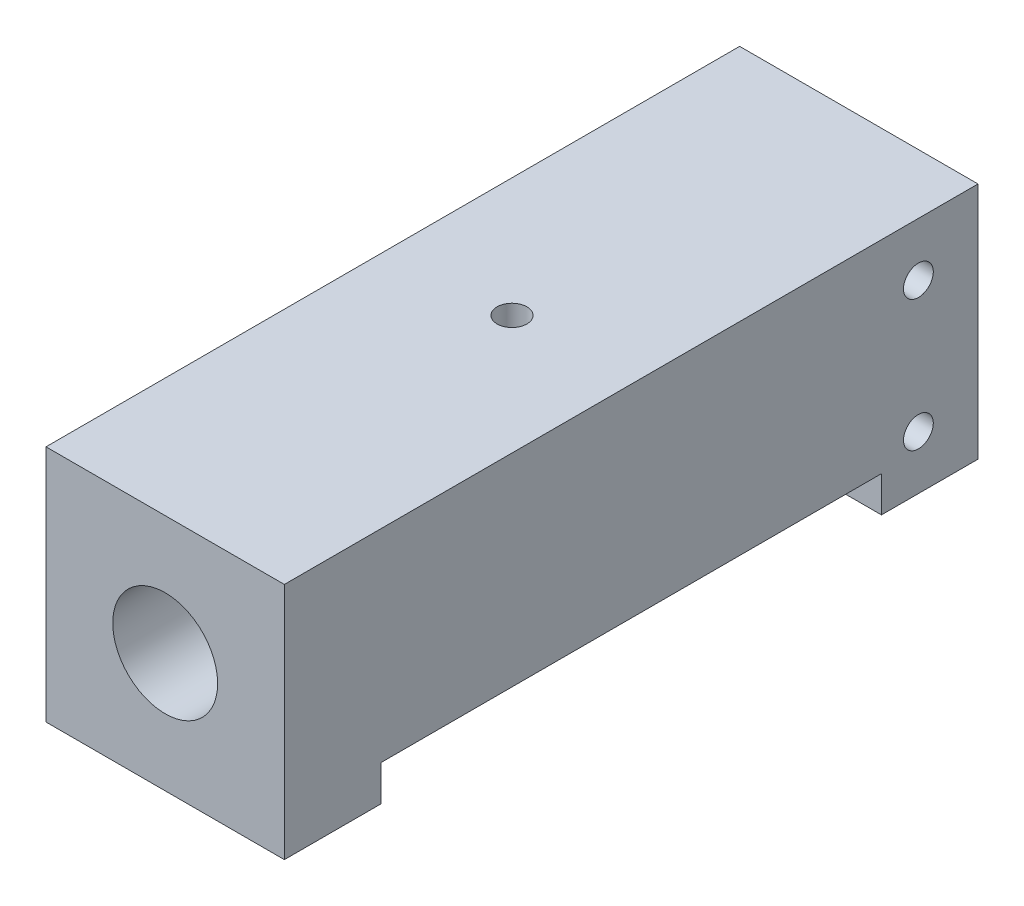
from build123d import *

# Parameters (mm, degrees)
SCHIZZO1_W                   = 20
SCHIZZO1_H                   = 20
ESTRUSIONE_ESTRUSIONE1_DEPTH = 58.2
SCHIZZO2_R                   = 2.05
TAGLIO_ESTRUSIONE1_DEPTH     = 60.893572276
FORO_FILETTATO_G1_8_1_D      = 8.8
FORO_FILETTATO_G1_8_1_DEPTH  = 10
FORO_FILETTATO_G1_8_1_TIP    = 2.643786724
M3_TAPPED_HOLE2_D            = 2.5
M3_TAPPED_HOLE2_DEPTH        = 5
M3_TAPPED_HOLE2_TIP          = 0.751075774
M3_TAPPED_HOLE3_D            = 2.5
SKETCH1_W                    = 36.2
SKETCH1_H                    = 6
BOSS_EXTRUDE1_DEPTH          = 4.9
CUT_EXTRUDE1_DEPTH           = 65.087830449
M3_TAPPED_HOLE4_D            = 2.5
M3_TAPPED_HOLE4_DEPTH        = 20
M3_TAPPED_HOLE4_TIP          = 0.751075774


with BuildPart() as part:
    # Schizzo1 → Estrusione-Estrusione1 (new body)
    with BuildSketch(Plane.XY):
        Rectangle(SCHIZZO1_W, SCHIZZO1_H)
    extrude(amount=-ESTRUSIONE_ESTRUSIONE1_DEPTH)

    # Schizzo2 → Taglio-Estrusione1 (cut, through all)
    with BuildSketch(Plane(origin=(0, 0, -58.2), x_dir=(-1, 0, 0), z_dir=(0, 0, -1))):
        Circle(SCHIZZO2_R)
    extrude(amount=-TAGLIO_ESTRUSIONE1_DEPTH, mode=Mode.SUBTRACT)

    # Foro filettato G1/8-1
    with Locations(Plane.XY):
        with Locations((0, 0)):
            Hole(FORO_FILETTATO_G1_8_1_D / 2, depth=FORO_FILETTATO_G1_8_1_DEPTH)
            with Locations((0, 0, -(FORO_FILETTATO_G1_8_1_DEPTH + FORO_FILETTATO_G1_8_1_TIP / 2))):  # 118° drill point
                Cone(0, FORO_FILETTATO_G1_8_1_D / 2, FORO_FILETTATO_G1_8_1_TIP, mode=Mode.SUBTRACT)

    # M3 Tapped Hole2
    with Locations(Plane(origin=(0, 10, -29.1), x_dir=(1, 0, 0), z_dir=(0, 1, 0))):
        with Locations((0, 0)):
            Hole(M3_TAPPED_HOLE2_D / 2, depth=M3_TAPPED_HOLE2_DEPTH)
            with Locations((0, 0, -(M3_TAPPED_HOLE2_DEPTH + M3_TAPPED_HOLE2_TIP / 2))):  # 118° drill point
                Cone(0, M3_TAPPED_HOLE2_D / 2, M3_TAPPED_HOLE2_TIP, mode=Mode.SUBTRACT)

    # Schizzo14 → Foro Ø16.0 (16)-1 (revolve, cut)
    with BuildSketch(Plane(origin=(0, 0, -58.2), x_dir=(0, 1, 0), z_dir=(1, 0, 0))):
        Polygon((0, 0), (0, 16.806884952), (8, 12), (8, 0), align=None)
    revolve(axis=Axis((0, 0, -64.55), (0, 0, 1)), mode=Mode.SUBTRACT)

    # M3 Tapped Hole3 (through all)
    with Locations(Plane(origin=(10, 5.5, -53.2), x_dir=(0, 0, 1), z_dir=(1, 0, 0))):
        with Locations((0, 0), (0, 11)):
            Hole(M3_TAPPED_HOLE3_D / 2)

    # Sketch1 → Boss-Extrude1 (add)
    with BuildSketch(Plane.ZY.offset(10)):
        with Locations((-40.1, 0)):
            Rectangle(SKETCH1_W, SKETCH1_H)
    extrude(amount=BOSS_EXTRUDE1_DEPTH)

    # Sketch2 → Cut-Extrude1 (cut, through all)
    with BuildSketch(Plane(origin=(10, 0, 0), x_dir=(0, 0, -1), z_dir=(1, 0, 0))):
        Polygon((50.1, -10), (34.1, -10), (8.1, -10), (8.1, -7), (34.1, -7), (50.1, -7), align=None)
    extrude(amount=-CUT_EXTRUDE1_DEPTH, mode=Mode.SUBTRACT)

    # M3 Tapped Hole4
    with Locations(Plane.XY.offset(-22)):
        with Locations((-13, 0)):
            Hole(M3_TAPPED_HOLE4_D / 2, depth=M3_TAPPED_HOLE4_DEPTH)
            with Locations((0, 0, -(M3_TAPPED_HOLE4_DEPTH + M3_TAPPED_HOLE4_TIP / 2))):  # 118° drill point
                Cone(0, M3_TAPPED_HOLE4_D / 2, M3_TAPPED_HOLE4_TIP, mode=Mode.SUBTRACT)


solid = part.part
